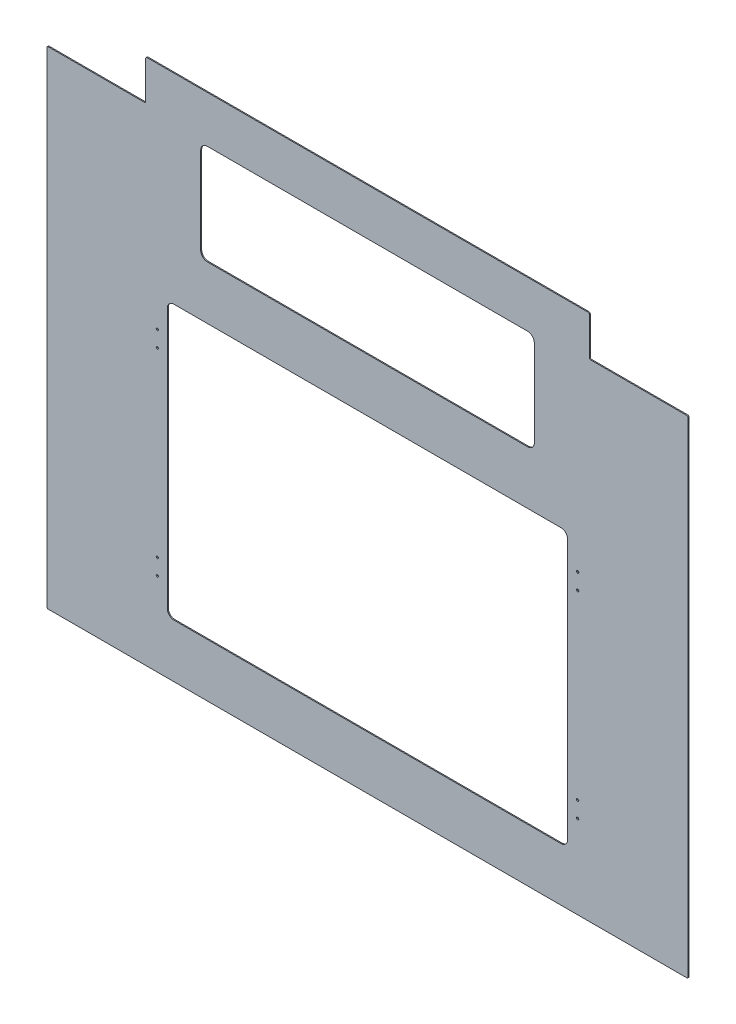
from build123d import *

# Parameters (mm, degrees)
SKETCH1_W            = 961
SKETCH1_H            = 790
SKETCH1_W_2          = 500
SKETCH1_H_2          = 150
BASE_FLANGE1_DEPTH   = 1.5
CUT_EXTRUDE1_REACH   = 926.653
SKETCH2_W            = 148
SKETCH2_H            = 60
CUT_EXTRUDE2_REACH   = 926.653
SKETCH3_W            = 600
SKETCH3_H            = 410
M3_CLEARANCE_HOLE1_D = 3.4
FILLET1_R            = 10
FILLET2_R            = 2


# Sheet-metal steps are written as plain solids
with BuildPart() as part:
    # Sketch1 → Base-Flange1 (new body)
    with BuildSketch(Plane.XY):
        with Locations((0, 395)):
            Rectangle(SKETCH1_W, SKETCH1_H)
        with Locations((0, 645)):
            Rectangle(SKETCH1_W_2, SKETCH1_H_2, mode=Mode.SUBTRACT)
    extrude(amount=-BASE_FLANGE1_DEPTH)

    # Sketch2 → Cut-Extrude1 (cut, up to next)
    with BuildSketch(Plane.XY, mode=Mode.PRIVATE) as cut_extrude1_sk1:
        with Locations((-406.5, 760)):
            Rectangle(SKETCH2_W, SKETCH2_H)
    cut_extrude1_tool1 = extrude(cut_extrude1_sk1.sketch, amount=-CUT_EXTRUDE1_REACH, mode=Mode.PRIVATE) & part.part
    cut_extrude1 = cut_extrude1_tool1.solids().sort_by_distance((-406.5, 760, 0))[0]
    add(cut_extrude1, mode=Mode.SUBTRACT)

    # Mirror1: Cut-Extrude1 across plane
    add(cut_extrude1.mirror(Plane(origin=(0, 0, 0), x_dir=(0, 0, 1), z_dir=(1, 0, 0))), mode=Mode.SUBTRACT)

    # Sketch3 → Cut-Extrude2 (cut, up to next)
    with BuildSketch(Plane(origin=(0, 0, -1.5), x_dir=(-1, 0, 0), z_dir=(0, 0, -1)), mode=Mode.PRIVATE) as cut_extrude2_sk1:
        with Locations((0, 285)):
            Rectangle(SKETCH3_W, SKETCH3_H)
    cut_extrude2_tool1 = extrude(cut_extrude2_sk1.sketch, amount=-CUT_EXTRUDE2_REACH, mode=Mode.PRIVATE) & part.part
    add(cut_extrude2_tool1.solids().sort_by_distance((0, 285, -1.5))[0], mode=Mode.SUBTRACT)

    # M3 Clearance Hole1 (through all)
    with Locations(Plane(origin=(0, 0, -1.5), x_dir=(-1, 0, 0), z_dir=(0, 0, -1))):
        with Locations((-315, 125), (-315, 149), (-315, 445), (-315, 421)):
            m3_clearance_hole1 = Hole(M3_CLEARANCE_HOLE1_D / 2)

    # Mirror2: M3 Clearance Hole1 across plane
    add(m3_clearance_hole1.mirror(Plane(origin=(0, 0, 0), x_dir=(0, 0, 1), z_dir=(1, 0, 0))), mode=Mode.SUBTRACT)

    # Fillet1
    fillet1_edges = [part.edges().sort_by_distance(p)[0] for p in [
        (-250, 720, -0.75),
        (250, 720, -0.75),
        (250, 570, -0.75),
        (-250, 570, -0.75),
        (-300, 490, -0.75),
        (-300, 80, -0.75),
        (300, 80, -0.75),
        (300, 490, -0.75),
    ]]
    fillet(fillet1_edges, radius=FILLET1_R)

    # Fillet2
    fillet2_edges = [part.edges().sort_by_distance(p)[0] for p in [
        (-480.5, 730, -0.75),
        (-332.5, 790, -0.75),
        (-332.5, 730, -0.75),
        (480.5, 730, -0.75),
        (332.5, 730, -0.75),
        (332.5, 790, -0.75),
        (480.5, 0, -0.75),
        (-480.5, 0, -0.75),
    ]]
    fillet(fillet2_edges, radius=FILLET2_R)


solid = part.part
